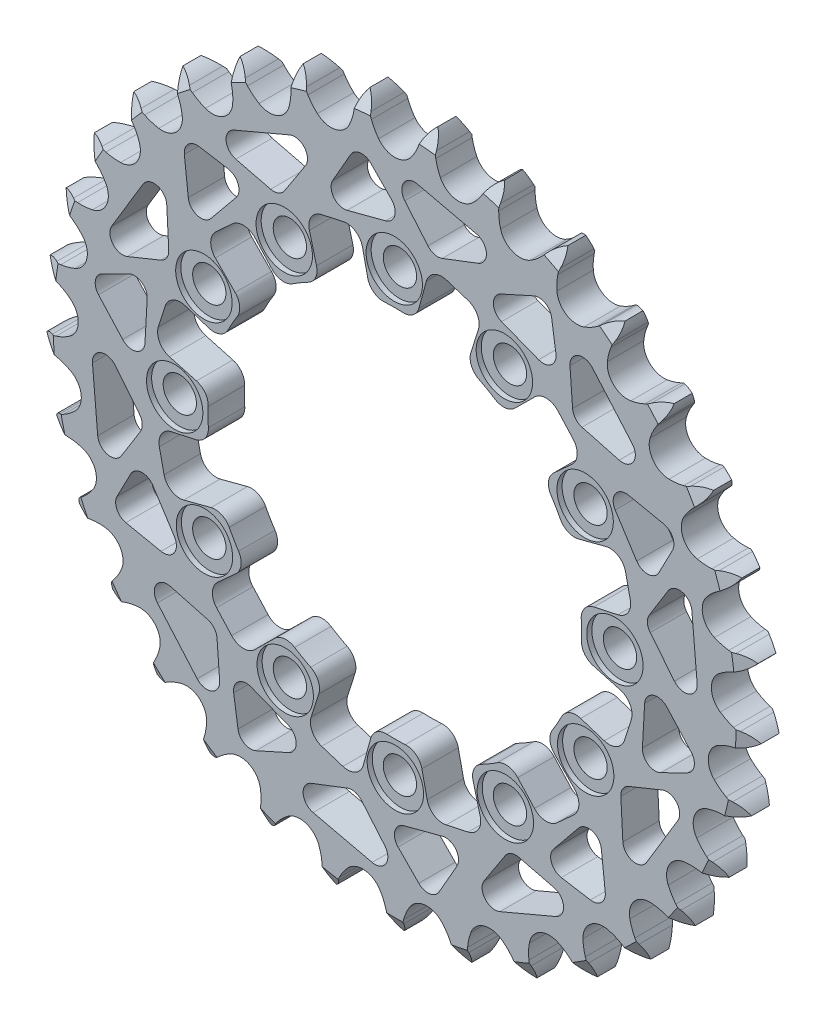
from build123d import *

# Parameters (mm, degrees)
EXTRUSION_DEPTH         = 7.2136
CIRPATTERN1_COUNT       = 12
CUT_EXTRUDE1_DEPTH      = 101.397293257
CUT_EXTRUDE1_DEPTH_BACK = 101.397293257
SKETCH8_R               = 37
CUT_EXTRUDE2_START      = 7.2136
SKETCH10_R              = 5.588
CUT_EXTRUDE2_DEPTH      = 1.016
CIRPATTERN2_COUNT       = 12
CUT_EXTRUDE5_REACH      = 102.397
CIRPATTERN3_COUNT       = 12
CUT_EXTRUDE7_REACH      = 102.397
CIRPATTERN4_COUNT       = 10
FILLET1_R               = 3.175


with BuildPart() as part:
    # Teeth Sketch → Extrusion (new body)
    with BuildSketch(Plane.XY):
        with BuildLine():
            ThreePointArc((6.734552875, 70.527428506), (5.727412099, 69.369502295), (5.022388138, 68.006393031))
            Line((5.022388138, 68.006393031), (4.635162245, 66.971544668))
            ThreePointArc((4.635162245, 66.971544668), (4.0137299, 65.635158722), (3.209237245, 64.400291471))
            ThreePointArc((3.209237245, 64.400291471), (0, 62.793862006), (-3.209237245, 64.400291471))
            ThreePointArc((-3.209237245, 64.400291471), (-4.0137299, 65.635158722), (-4.635162245, 66.971544668))
            Line((-4.635162245, 66.971544668), (-5.022388138, 68.006393031))
            ThreePointArc((-5.022388138, 68.006393031), (-5.727412099, 69.369502295), (-6.734552875, 70.527428506))
            ThreePointArc((-6.734552875, 70.527428506), (-7.504354329, 69.199824885), (-7.938667464, 67.727922119))
            Line((-7.938667464, 67.727922119), (-8.123049341, 66.638491832))
            ThreePointArc((-8.123049341, 66.638491832), (-8.48033889, 65.208649276), (-9.036593151, 63.84384645))
            ThreePointArc((-9.036593151, 63.84384645), (-11.883816523, 61.659095115), (-15.339077445, 62.629142165))
            ThreePointArc((-15.339077445, 62.629142165), (-16.362732034, 63.68944252), (-17.22584699, 64.884071387))
            Line((-17.22584699, 64.884071387), (-17.801921547, 65.826935709))
            ThreePointArc((-17.801921547, 65.826935709), (-18.752174931, 67.031985151), (-19.960254337, 67.978383482))
            ThreePointArc((-19.960254337, 67.978383482), (-20.464893839, 66.529085505), (-20.61279894, 65.001587639))
            Line((-20.61279894, 65.001587639), (-20.587672758, 63.896950277))
            ThreePointArc((-20.587672758, 63.896950277), (-20.667906137, 62.425329346), (-20.955817525, 60.979918474))
            ThreePointArc((-20.955817525, 60.979918474), (-23.338120953, 58.295807876), (-26.914523421, 58.594412483))
            ThreePointArc((-26.914523421, 58.594412483), (-28.120342399, 59.441823925), (-29.193944743, 60.451518712))
            Line((-29.193944743, 60.451518712), (-29.938047129, 61.268321421))
            ThreePointArc((-29.938047129, 61.268321421), (-31.099185303, 62.271757414), (-32.464540202, 62.972422563))
            ThreePointArc((-32.464540202, 62.972422563), (-32.685778765, 61.453811636), (-32.541930156, 59.925926421))
            Line((-32.541930156, 59.925926421), (-32.308204042, 58.846006456))
            ThreePointArc((-32.308204042, 58.846006456), (-32.108481407, 57.385795366), (-32.117644055, 55.912017363))
            ThreePointArc((-32.117644055, 55.912017363), (-33.948924886, 52.825558252), (-37.517208396, 52.441928068))
            ThreePointArc((-37.517208396, 52.441928068), (-38.861610323, 53.045822938), (-40.106897269, 53.834090646))
            Line((-40.106897269, 53.834090646), (-40.992133685, 54.495310364))
            ThreePointArc((-40.992133685, 54.495310364), (-42.32219009, 55.260866117), (-43.795472998, 55.69047422))
            ThreePointArc((-43.795472998, 55.69047422), (-43.725314484, 54.157436897), (-43.294911229, 52.684386087))
            Line((-43.294911229, 52.684386087), (-42.861032653, 51.668214641))
            ThreePointArc((-42.861032653, 51.668214641), (-42.388572501, 50.272189225), (-42.118655247, 48.823310267))
            ThreePointArc((-42.118655247, 48.823310267), (-43.33272622, 45.446055318), (-46.763923708, 44.394055736))
            ThreePointArc((-46.763923708, 44.394055736), (-48.198318397, 44.732607702), (-49.570282031, 45.270958281))
            Line((-49.570282031, 45.270958281), (-50.564657725, 45.752696804))
            ThreePointArc((-50.564657725, 45.752696804), (-52.015560657, 46.252703137), (-53.543523293, 46.395727039))
            ThreePointArc((-53.543523293, 46.395727039), (-53.184503413, 44.903671283), (-52.483101407, 43.538694772))
            Line((-52.483101407, 43.538694772), (-51.864751871, 42.622998928))
            ThreePointArc((-51.864751871, 42.622998928), (-51.136630142, 41.341615182), (-50.597388499, 39.970001531))
            ThreePointArc((-50.597388499, 39.970001531), (-51.150369926, 36.424013535), (-54.320468976, 34.741666562))
            ThreePointArc((-54.320468976, 34.741666562), (-55.793013665, 34.802639473), (-57.242067645, 35.071615531))
            Line((-57.242067645, 35.071615531), (-58.309643291, 35.356461573))
            ThreePointArc((-58.309643291, 35.356461573), (-59.828953337, 35.572846956), (-61.356371149, 35.424117399))
            ThreePointArc((-61.356371149, 35.424117399), (-60.721465817, 34.026969994), (-59.774415556, 32.819401589))
            Line((-59.774415556, 32.819401589), (-58.993943824, 32.037276981))
            ThreePointArc((-58.993943824, 32.037276981), (-58.036476735, 30.916847451), (-57.2474003, 29.672072798))
            ThreePointArc((-57.2474003, 29.672072798), (-57.119305992, 26.085513002), (-59.913730964, 23.83362304))
            ThreePointArc((-59.913730964, 23.83362304), (-61.371204052, 23.614813176), (-62.844975793, 23.604693218))
            Line((-62.844975793, 23.604693218), (-63.947166423, 23.682351702))
            ThreePointArc((-63.947166423, 23.682351702), (-65.479971761, 23.607295402), (-66.951639889, 23.17218786))
            ThreePointArc((-66.951639889, 23.17218786), (-66.063796239, 21.920445353), (-64.905326586, 20.913929722))
            Line((-64.905326586, 20.913929722), (-63.99094094, 20.293644371))
            ThreePointArc((-63.99094094, 20.293644371), (-62.838733846, 19.374664301), (-61.828341898, 18.301718044))
            ThreePointArc((-61.828341898, 18.301718044), (-61.023801517, 14.804214063), (-63.341554612, 12.064170283))
            ThreePointArc((-63.341554612, 12.064170283), (-64.731279223, 11.573486003), (-66.176502774, 11.28463579))
            Line((-66.176502774, 11.28463579), (-67.273472348, 11.152299936))
            ThreePointArc((-67.273472348, 11.152299936), (-68.764373399, 10.788514683), (-70.127101923, 10.082755077))
            ThreePointArc((-70.127101923, 10.082755077), (-69.018408937, 9.021658703), (-67.690390004, 8.252573944))
            Line((-67.690390004, 8.252573944), (-66.675138724, 7.816546579))
            ThreePointArc((-66.675138724, 7.816546579), (-65.369835391, 7.132230303), (-64.174646128, 6.269891516))
            ThreePointArc((-64.174646128, 6.269891516), (-62.722737859, 2.987852256), (-64.480049441, -0.14131302))
            ThreePointArc((-64.480049441, -0.14131302), (-65.751797307, -0.886137108), (-67.116238523, -1.443277777))
            Line((-67.116238523, -1.443277777), (-68.168339704, -1.780825007))
            ThreePointArc((-68.168339704, -1.780825007), (-69.563451418, -2.420191065), (-70.767987779, -3.371094744))
            ThreePointArc((-70.767987779, -3.371094744), (-69.478516511, -4.203194198), (-68.028946362, -4.707051357))
            Line((-68.028946362, -4.707051357), (-66.949523274, -4.943061572))
            ThreePointArc((-66.949523274, -4.943061572), (-65.538300765, -5.367981082), (-64.201511441, -5.988545228))
            ThreePointArc((-64.201511441, -5.988545228), (-62.154711032, -8.936498316), (-63.288067282, -12.341688903))
            ThreePointArc((-63.288067282, -12.341688903), (-64.395874122, -13.313732915), (-65.630218543, -14.119027525))
            Line((-65.630218543, -14.119027525), (-66.599425651, -14.649586294))
            ThreePointArc((-66.599425651, -14.649586294), (-67.848325057, -15.541424803), (-68.851134172, -16.703104419))
            ThreePointArc((-68.851134172, -16.703104419), (-67.427489473, -17.276132709), (-65.908759351, -17.496551559))
            Line((-65.908759351, -17.496551559), (-64.804177617, -17.524014599))
            ThreePointArc((-64.804177617, -17.524014599), (-63.338041192, -17.674179644), (-61.907966855, -18.030540344))
            ThreePointArc((-61.907966855, -18.030540344), (-59.340251006, -20.537860555), (-59.808689476, -24.096003993))
            ThreePointArc((-59.808689476, -24.096003993), (-60.712516265, -25.260135726), (-61.772151467, -26.284478831))
            Line((-61.772151467, -26.284478831), (-62.623434833, -26.988873364))
            ThreePointArc((-62.623434833, -26.988873364), (-63.680983452, -28.100950955), (-64.445821187, -29.43142038))
            ThreePointArc((-64.445821187, -29.43142038), (-62.939457285, -29.724666771), (-61.406458053, -29.6536808))
            Line((-61.406458053, -29.6536808), (-60.316640136, -29.471604079))
            ThreePointArc((-60.316640136, -29.471604079), (-58.848579784, -29.341587304), (-57.376907048, -29.420864754))
            ThreePointArc((-57.376907048, -29.420864754), (-54.381079699, -31.396931003), (-54.167669802, -34.979426717))
            ThreePointArc((-54.167669802, -34.979426717), (-54.834849884, -36.293571418), (-55.681477891, -37.499940589))
            Line((-55.681477891, -37.499940589), (-56.384069915, -38.352712231))
            ThreePointArc((-56.384069915, -38.352712231), (-57.212045185, -39.644835523), (-57.711268312, -41.096008126))
            ThreePointArc((-57.711268312, -41.096008126), (-56.176629123, -41.09887393), (-54.684767369, -40.739048756))
            Line((-54.684767369, -40.739048756), (-53.649102126, -40.354013001))
            ThreePointArc((-53.649102126, -40.354013001), (-52.232177374, -39.94851355), (-50.772096325, -39.747842457))
            ThreePointArc((-50.772096325, -39.747842457), (-47.456434483, -41.12123456), (-46.56888941, -44.598601821))
            ThreePointArc((-46.56888941, -44.598601821), (-46.975309158, -46.015262876), (-47.578330627, -47.360056788))
            Line((-47.578330627, -47.360056788), (-48.106837804, -48.330384151))
            ThreePointArc((-48.106837804, -48.330384151), (-48.675314541, -49.755852442), (-48.890879835, -51.275279063))
            ThreePointArc((-48.890879835, -51.275279063), (-47.383431219, -50.987660703), (-45.986626711, -50.352001344))
            Line((-45.986626711, -50.352001344), (-45.042545785, -49.777922752))
            ThreePointArc((-45.042545785, -49.777922752), (-43.727967985, -49.111596431), (-42.332249756, -48.638229571))
            ThreePointArc((-42.332249756, -48.638229571), (-38.816590078, -49.35930956), (-37.28698802, -52.605867255))
            ThreePointArc((-37.28698802, -52.605867255), (-37.417958367, -54.073842843), (-37.75557853, -55.50845714))
            Line((-37.75557853, -55.50845714), (-38.090899233, -56.561270064))
            ThreePointArc((-38.090899233, -56.561270064), (-38.379331208, -58.068563217), (-38.303447577, -59.601327819))
            ThreePointArc((-38.303447577, -59.601327819), (-36.877672653, -59.03362057), (-35.626409548, -58.145101414))
            Line((-35.626409548, -58.145101414), (-34.808034481, -57.402728679))
            ThreePointArc((-34.808034481, -57.402728679), (-33.6433159, -56.499658259), (-32.362405386, -55.770704343))
            ThreePointArc((-32.362405386, -55.770704343), (-28.773812973, -55.813410509), (-26.657437732, -58.711819583))
            ThreePointArc((-26.657437732, -58.711819583), (-26.508225068, -60.178053241), (-26.568241455, -61.650637225))
            Line((-26.568241455, -61.650637225), (-26.69825632, -62.747884308))
            ThreePointArc((-26.69825632, -62.747884308), (-26.696218847, -64.28252482), (-26.331628924, -65.773229298))
            ThreePointArc((-26.331628924, -65.773229298), (-25.039058915, -64.94595158), (-23.978561119, -63.836686022))
            Line((-23.978561119, -63.836686022), (-23.31547012, -62.952850431))
            ThreePointArc((-23.31547012, -62.952850431), (-22.342706722, -61.845675228), (-21.222899365, -60.887480551))
            ThreePointArc((-21.222899365, -60.887480551), (-17.691075297, -60.250269381), (-15.06441819, -62.69577378))
            ThreePointArc((-15.06441819, -62.69577378), (-14.640415448, -64.107272002), (-14.42065891, -65.564602652))
            Line((-14.42065891, -65.564602652), (-14.340668861, -66.666626525))
            ThreePointArc((-14.340668861, -66.666626525), (-14.048235582, -68.17314849), (-13.408116596, -69.567914899))
            ThreePointArc((-13.408116596, -69.567914899), (-12.295468348, -68.510966685), (-11.464065017, -67.221046473))
            Line((-11.464065017, -67.221046473), (-10.980223921, -66.227692145))
            ThreePointArc((-10.980223921, -66.227692145), (-10.23457391, -64.956428358), (-9.316342465, -63.80362457))
            ThreePointArc((-9.316342465, -63.80362457), (-5.968936066, -62.509526537), (-2.926931324, -64.413739359))
            ThreePointArc((-2.926931324, -64.413739359), (-2.24346307, -65.719486924), (-1.751876179, -67.108892511))
            Line((-1.751876179, -67.108892511), (-1.464772265, -68.175863162))
            ThreePointArc((-1.464772265, -68.175863162), (-0.89251248, -69.59981695), (0, -70.848234798))
            ThreePointArc((0, -70.848234798), (0.89251248, -69.59981695), (1.464772265, -68.175863162))
            Line((1.464772265, -68.175863162), (1.751876179, -67.108892511))
            ThreePointArc((1.751876179, -67.108892511), (2.24346307, -65.719486924), (2.926931324, -64.413739359))
            ThreePointArc((2.926931324, -64.413739359), (5.968936066, -62.509526537), (9.316342465, -63.80362457))
            ThreePointArc((9.316342465, -63.80362457), (10.23457391, -64.956428358), (10.980223921, -66.227692145))
            Line((10.980223921, -66.227692145), (11.464065017, -67.221046473))
            ThreePointArc((11.464065017, -67.221046473), (12.295468348, -68.510966685), (13.408116596, -69.567914899))
            ThreePointArc((13.408116596, -69.567914899), (14.048235582, -68.17314849), (14.340668861, -66.666626525))
            Line((14.340668861, -66.666626525), (14.42065891, -65.564602652))
            ThreePointArc((14.42065891, -65.564602652), (14.640415448, -64.107272002), (15.06441819, -62.69577378))
            ThreePointArc((15.06441819, -62.69577378), (17.691075297, -60.250269381), (21.222899365, -60.887480551))
            ThreePointArc((21.222899365, -60.887480551), (22.342706722, -61.845675228), (23.31547012, -62.952850431))
            Line((23.31547012, -62.952850431), (23.978561119, -63.836686022))
            ThreePointArc((23.978561119, -63.836686022), (25.039058915, -64.94595158), (26.331628924, -65.773229298))
            ThreePointArc((26.331628924, -65.773229298), (26.696218847, -64.28252482), (26.69825632, -62.747884308))
            Line((26.69825632, -62.747884308), (26.568241455, -61.650637225))
            ThreePointArc((26.568241455, -61.650637225), (26.508225068, -60.178053241), (26.657437732, -58.711819583))
            ThreePointArc((26.657437732, -58.711819583), (28.773812973, -55.813410509), (32.362405386, -55.770704343))
            ThreePointArc((32.362405386, -55.770704343), (33.6433159, -56.499658259), (34.808034481, -57.402728679))
            Line((34.808034481, -57.402728679), (35.626409548, -58.145101414))
            ThreePointArc((35.626409548, -58.145101414), (36.877672653, -59.03362057), (38.303447577, -59.601327819))
            ThreePointArc((38.303447577, -59.601327819), (38.379331208, -58.068563217), (38.090899233, -56.561270064))
            Line((38.090899233, -56.561270064), (37.75557853, -55.50845714))
            ThreePointArc((37.75557853, -55.50845714), (37.417958367, -54.073842843), (37.28698802, -52.605867255))
            ThreePointArc((37.28698802, -52.605867255), (38.816590078, -49.35930956), (42.332249756, -48.638229571))
            ThreePointArc((42.332249756, -48.638229571), (43.727967985, -49.111596431), (45.042545785, -49.777922752))
            Line((45.042545785, -49.777922752), (45.986626711, -50.352001344))
            ThreePointArc((45.986626711, -50.352001344), (47.383431219, -50.987660703), (48.890879835, -51.275279063))
            ThreePointArc((48.890879835, -51.275279063), (48.675314541, -49.755852442), (48.106837804, -48.330384151))
            Line((48.106837804, -48.330384151), (47.578330627, -47.360056788))
            ThreePointArc((47.578330627, -47.360056788), (46.975309158, -46.015262876), (46.56888941, -44.598601821))
            ThreePointArc((46.56888941, -44.598601821), (47.456434483, -41.12123456), (50.772096325, -39.747842457))
            ThreePointArc((50.772096325, -39.747842457), (52.232177374, -39.94851355), (53.649102126, -40.354013001))
            Line((53.649102126, -40.354013001), (54.684767369, -40.739048756))
            ThreePointArc((54.684767369, -40.739048756), (56.176629123, -41.09887393), (57.711268312, -41.096008126))
            ThreePointArc((57.711268312, -41.096008126), (57.212045185, -39.644835523), (56.384069915, -38.352712231))
            Line((56.384069915, -38.352712231), (55.681477891, -37.499940589))
            ThreePointArc((55.681477891, -37.499940589), (54.834849884, -36.293571418), (54.167669802, -34.979426717))
            ThreePointArc((54.167669802, -34.979426717), (54.381079699, -31.396931003), (57.376907048, -29.420864754))
            ThreePointArc((57.376907048, -29.420864754), (58.848579784, -29.341587304), (60.316640136, -29.471604079))
            Line((60.316640136, -29.471604079), (61.406458053, -29.6536808))
            ThreePointArc((61.406458053, -29.6536808), (62.939457285, -29.724666771), (64.445821187, -29.43142038))
            ThreePointArc((64.445821187, -29.43142038), (63.680983452, -28.100950955), (62.623434833, -26.988873364))
            Line((62.623434833, -26.988873364), (61.772151467, -26.284478831))
            ThreePointArc((61.772151467, -26.284478831), (60.712516265, -25.260135726), (59.808689476, -24.096003993))
            ThreePointArc((59.808689476, -24.096003993), (59.340251006, -20.537860555), (61.907966855, -18.030540344))
            ThreePointArc((61.907966855, -18.030540344), (63.338041192, -17.674179644), (64.804177617, -17.524014599))
            Line((64.804177617, -17.524014599), (65.908759351, -17.496551559))
            ThreePointArc((65.908759351, -17.496551559), (67.427489473, -17.276132709), (68.851134172, -16.703104419))
            ThreePointArc((68.851134172, -16.703104419), (67.848325057, -15.541424803), (66.599425651, -14.649586294))
            Line((66.599425651, -14.649586294), (65.630218543, -14.119027525))
            ThreePointArc((65.630218543, -14.119027525), (64.395874122, -13.313732915), (63.288067282, -12.341688903))
            ThreePointArc((63.288067282, -12.341688903), (62.154711032, -8.936498316), (64.201511441, -5.988545228))
            ThreePointArc((64.201511441, -5.988545228), (65.538300765, -5.367981082), (66.949523274, -4.943061572))
            Line((66.949523274, -4.943061572), (68.028946362, -4.707051357))
            ThreePointArc((68.028946362, -4.707051357), (69.478516511, -4.203194198), (70.767987779, -3.371094744))
            ThreePointArc((70.767987779, -3.371094744), (69.563451418, -2.420191065), (68.168339704, -1.780825007))
            Line((68.168339704, -1.780825007), (67.116238523, -1.443277777))
            ThreePointArc((67.116238523, -1.443277777), (65.751797307, -0.886137108), (64.480049441, -0.14131302))
            ThreePointArc((64.480049441, -0.14131302), (62.722737859, 2.987852256), (64.174646128, 6.269891516))
            ThreePointArc((64.174646128, 6.269891516), (65.369835391, 7.132230303), (66.675138724, 7.816546579))
            Line((66.675138724, 7.816546579), (67.690390004, 8.252573944))
            ThreePointArc((67.690390004, 8.252573944), (69.018408937, 9.021658703), (70.127101923, 10.082755077))
            ThreePointArc((70.127101923, 10.082755077), (68.764373399, 10.788514683), (67.273472348, 11.152299936))
            Line((67.273472348, 11.152299936), (66.176502774, 11.28463579))
            ThreePointArc((66.176502774, 11.28463579), (64.731279223, 11.573486003), (63.341554612, 12.064170283))
            ThreePointArc((63.341554612, 12.064170283), (61.023801517, 14.804214063), (61.828341898, 18.301718044))
            ThreePointArc((61.828341898, 18.301718044), (62.838733846, 19.374664301), (63.99094094, 20.293644371))
            Line((63.99094094, 20.293644371), (64.905326586, 20.913929722))
            ThreePointArc((64.905326586, 20.913929722), (66.063796239, 21.920445353), (66.951639889, 23.17218786))
            ThreePointArc((66.951639889, 23.17218786), (65.479971761, 23.607295402), (63.947166423, 23.682351702))
            Line((63.947166423, 23.682351702), (62.844975793, 23.604693218))
            ThreePointArc((62.844975793, 23.604693218), (61.371204052, 23.614813176), (59.913730964, 23.83362304))
            ThreePointArc((59.913730964, 23.83362304), (57.119305992, 26.085513002), (57.2474003, 29.672072798))
            ThreePointArc((57.2474003, 29.672072798), (58.036476735, 30.916847451), (58.993943824, 32.037276981))
            Line((58.993943824, 32.037276981), (59.774415556, 32.819401589))
            ThreePointArc((59.774415556, 32.819401589), (60.721465817, 34.026969994), (61.356371149, 35.424117399))
            ThreePointArc((61.356371149, 35.424117399), (59.828953337, 35.572846956), (58.309643291, 35.356461573))
            Line((58.309643291, 35.356461573), (57.242067645, 35.071615531))
            ThreePointArc((57.242067645, 35.071615531), (55.793013665, 34.802639473), (54.320468976, 34.741666562))
            ThreePointArc((54.320468976, 34.741666562), (51.150369926, 36.424013535), (50.597388499, 39.970001531))
            ThreePointArc((50.597388499, 39.970001531), (51.136630142, 41.341615182), (51.864751871, 42.622998928))
            Line((51.864751871, 42.622998928), (52.483101407, 43.538694772))
            ThreePointArc((52.483101407, 43.538694772), (53.184503413, 44.903671283), (53.543523293, 46.395727039))
            ThreePointArc((53.543523293, 46.395727039), (52.015560657, 46.252703137), (50.564657725, 45.752696804))
            Line((50.564657725, 45.752696804), (49.570282031, 45.270958281))
            ThreePointArc((49.570282031, 45.270958281), (48.198318397, 44.732607702), (46.763923708, 44.394055736))
            ThreePointArc((46.763923708, 44.394055736), (43.33272622, 45.446055318), (42.118655247, 48.823310267))
            ThreePointArc((42.118655247, 48.823310267), (42.388572501, 50.272189225), (42.861032653, 51.668214641))
            Line((42.861032653, 51.668214641), (43.294911229, 52.684386087))
            ThreePointArc((43.294911229, 52.684386087), (43.725314484, 54.157436897), (43.795472998, 55.69047422))
            ThreePointArc((43.795472998, 55.69047422), (42.32219009, 55.260866117), (40.992133685, 54.495310364))
            Line((40.992133685, 54.495310364), (40.106897269, 53.834090646))
            ThreePointArc((40.106897269, 53.834090646), (38.861610323, 53.045822938), (37.517208396, 52.441928068))
            ThreePointArc((37.517208396, 52.441928068), (33.948924886, 52.825558252), (32.117644055, 55.912017363))
            ThreePointArc((32.117644055, 55.912017363), (32.108481407, 57.385795366), (32.308204042, 58.846006456))
            Line((32.308204042, 58.846006456), (32.541930156, 59.925926421))
            ThreePointArc((32.541930156, 59.925926421), (32.685778765, 61.453811636), (32.464540202, 62.972422563))
            ThreePointArc((32.464540202, 62.972422563), (31.099185303, 62.271757414), (29.938047129, 61.268321421))
            Line((29.938047129, 61.268321421), (29.193944743, 60.451518712))
            ThreePointArc((29.193944743, 60.451518712), (28.120342399, 59.441823925), (26.914523421, 58.594412483))
            ThreePointArc((26.914523421, 58.594412483), (23.338120953, 58.295807876), (20.955817525, 60.979918474))
            ThreePointArc((20.955817525, 60.979918474), (20.667906137, 62.425329346), (20.587672758, 63.896950277))
            Line((20.587672758, 63.896950277), (20.61279894, 65.001587639))
            ThreePointArc((20.61279894, 65.001587639), (20.464893839, 66.529085505), (19.960254337, 67.978383482))
            ThreePointArc((19.960254337, 67.978383482), (18.752174931, 67.031985151), (17.801921547, 65.826935709))
            Line((17.801921547, 65.826935709), (17.22584699, 64.884071387))
            ThreePointArc((17.22584699, 64.884071387), (16.362732034, 63.68944252), (15.339077445, 62.629142165))
            ThreePointArc((15.339077445, 62.629142165), (11.883816523, 61.659095115), (9.036593151, 63.84384645))
            ThreePointArc((9.036593151, 63.84384645), (8.48033889, 65.208649276), (8.123049341, 66.638491832))
            Line((8.123049341, 66.638491832), (7.938667464, 67.727922119))
            ThreePointArc((7.938667464, 67.727922119), (7.504354329, 69.199824885), (6.734552875, 70.527428506))
        make_face()
    extrude(amount=EXTRUSION_DEPTH)

    # Sketch7 → M6 Clearance Hole1 (revolve, cut)
    with BuildSketch(Plane(origin=(0, 43.500000122, 0), x_dir=(0, 1, 0), z_dir=(1, 0, 0))):
        Polygon((0, 0), (0, 19.254840043), (3.3, 17.272), (3.3, 0), align=None)
    m6_clearance_hole1 = revolve(axis=Axis((0, 43.500000122, -6.35), (0, 0, 1)), mode=Mode.SUBTRACT)

    # CirPattern1: M6 Clearance Hole1 ×12 about axis
    cirpattern1_axis = Axis((0, -0.110734981, 0), (0, 0, 1))
    for i in range(1, CIRPATTERN1_COUNT):
        add(m6_clearance_hole1.rotate(cirpattern1_axis, i * 360 / CIRPATTERN1_COUNT), mode=Mode.SUBTRACT)

    # Sketch8 → Cut-Extrude1 (cut, two sides: drawn at the far end of the back side and taken through both)
    with BuildSketch(Plane(origin=(0, 0, 0), x_dir=(-1, 0, 0), z_dir=(0, 0, -1)).offset(-CUT_EXTRUDE1_DEPTH_BACK)):
        Circle(SKETCH8_R)
    extrude(amount=CUT_EXTRUDE1_DEPTH + CUT_EXTRUDE1_DEPTH_BACK, mode=Mode.SUBTRACT)

    # Sketch5 → Cut-Revolve1 (revolve, cut)
    with BuildSketch(Plane(origin=(0, 0, 0), x_dir=(0, 0, -1), z_dir=(1, 0, 0))):
        Polygon((-7.2136, -67.654652666), (-7.2136, -70.848234798), (-5.3848, -70.848234798), align=None)
    cut_revolve1 = revolve(axis=Axis((0, 0, 7.2136), (0, 0, -1)), mode=Mode.SUBTRACT)

    # Mirror1: Cut-Revolve1 across plane
    add(cut_revolve1.mirror(Plane.XY.offset(3.6068)), mode=Mode.SUBTRACT)

    # Sketch10 → Cut-Extrude2 (cut)
    with BuildSketch(Plane.XY.offset(CUT_EXTRUDE2_START)):
        with Locations((-43.610735103, -0.110734981)):
            Circle(SKETCH10_R)
    cut_extrude2 = extrude(amount=-CUT_EXTRUDE2_DEPTH, mode=Mode.SUBTRACT)

    # CirPattern2: Cut-Extrude2 ×12 about axis
    cirpattern2_axis = Axis((0, 0, 0), (0, 0, 1))
    for i in range(1, CIRPATTERN2_COUNT):
        add(cut_extrude2.rotate(cirpattern2_axis, i * 360 / CIRPATTERN2_COUNT), mode=Mode.SUBTRACT)

    # Sketch12 → Cut-Extrude5 (cut, up to next)
    with BuildSketch(Plane.XY.offset(7.2136), mode=Mode.PRIVATE) as cut_extrude5_sk1:
        with BuildLine():
            Line((6.250553131, 44.666758148), (4.490126769, 38.246443199))
            ThreePointArc((4.490126769, 38.246443199), (4.793284827, 35.835387705), (6.712523637, 34.344879133))
            Line((6.712523637, 34.344879133), (10.729526032, 33.243432091))
            ThreePointArc((10.729526032, 33.243432091), (13.083067136, 33.514613806), (14.593666251, 35.339657796))
            Line((14.593666251, 35.339657796), (16.564401951, 41.511619817))
            ThreePointArc((16.564401951, 41.511619817), (16.361421568, 43.933167333), (14.505600093, 45.501931197))
            Line((14.505600093, 45.501931197), (10.278288359, 46.851731167))
            ThreePointArc((10.278288359, 46.851731167), (7.798576093, 46.6179733), (6.250553131, 44.666758148))
        make_face()
    cut_extrude5_tool1 = extrude(cut_extrude5_sk1.sketch, amount=-CUT_EXTRUDE5_REACH, mode=Mode.PRIVATE) & part.part
    cut_extrude5 = cut_extrude5_tool1.solids().sort_by_distance((10.48706, 40.048077, 7.2136))[0]
    add(cut_extrude5, mode=Mode.SUBTRACT)

    # CirPattern3: Cut-Extrude5 ×12 about axis
    cirpattern3_axis = Axis((0, 0, 0), (0, 0, 1))
    for i in range(1, CIRPATTERN3_COUNT):
        add(cut_extrude5.rotate(cirpattern3_axis, i * 360 / CIRPATTERN3_COUNT), mode=Mode.SUBTRACT)

    # Sketch13 → Cut-Extrude7 (cut, up to next)
    with BuildSketch(Plane.XY.offset(7.2136), mode=Mode.PRIVATE) as cut_extrude7_sk1:
        with BuildLine():
            Line((-12.29503781, 52.699348233), (-8.766956721, 58.874555746))
            ThreePointArc((-8.766956721, 58.874555746), (-6.886929375, 60.133596514), (-4.748676784, 59.393621964))
            Line((-4.748676784, 59.393621964), (-0.656757873, 55.224069994))
            ThreePointArc((-0.656757873, 55.224069994), (-0.020757561, 52.770631729), (-1.823075281, 50.988636624))
            Line((-1.823075281, 50.988636624), (-9.443075281, 48.982981081))
            ThreePointArc((-9.443075281, 48.982981081), (-12.104647123, 49.892965008), (-12.29503781, 52.699348233))
        make_face()
    cut_extrude7_tool1 = extrude(cut_extrude7_sk1.sketch, amount=-CUT_EXTRUDE7_REACH, mode=Mode.PRIVATE) & part.part
    # Sketch13 → Cut-Extrude7 (cut, up to next)
    with BuildSketch(Plane.XY.offset(7.2136), mode=Mode.PRIVATE) as cut_extrude7_sk2:
        with BuildLine():
            Line((1.979717897, 56.320855635), (6.567308468, 50.886285113))
            ThreePointArc((6.567308468, 50.886285113), (7.875401815, 50.064805257), (9.417527045, 50.153050025))
            Line((9.417527045, 50.153050025), (16.53250792, 52.880951625))
            ThreePointArc((16.53250792, 52.880951625), (18.15709085, 55.428778294), (16.195570256, 57.727283763))
            Line((16.195570256, 57.727283763), (4.49299881, 60.433952684))
            ThreePointArc((4.49299881, 60.433952684), (1.753234812, 59.28365705), (1.979717897, 56.320855635))
        make_face()
    cut_extrude7_tool2 = extrude(cut_extrude7_sk2.sketch, amount=-CUT_EXTRUDE7_REACH, mode=Mode.PRIVATE) & part.part
    cut_extrude7_1 = cut_extrude7_tool1.solids().sort_by_distance((-6.467527, 54.029656, 7.2136))[0]
    add(cut_extrude7_1, mode=Mode.SUBTRACT)
    cut_extrude7_2 = cut_extrude7_tool2.solids().sort_by_distance((9.466435, 55.47639, 7.2136))[0]
    add(cut_extrude7_2, mode=Mode.SUBTRACT)
    cut_extrude7 = cut_extrude7_1 + cut_extrude7_2  # Cut-Extrude7 as one shape, for the pattern or mirror that repeats it

    # CirPattern4: Cut-Extrude7 ×10 about axis
    cirpattern4_axis = Axis((0, 0, 0), (0, 0, 1))
    for i in range(1, CIRPATTERN4_COUNT):
        add(cut_extrude7.rotate(cirpattern4_axis, i * 360 / CIRPATTERN4_COUNT), mode=Mode.SUBTRACT)

    # Fillet1
    fillet1_edges = [part.edges().sort_by_distance(p)[0] for p in [
        (5.00954039, -36.659303118, 3.6068),
        (-4.449777797, -36.731450796, 3.6068),
        (22.668040798, -29.24311759, 3.6068),
        (14.512104784, -34.035258405, 3.6068),
        (29.585480608, -22.219346011, 3.6068),
        (34.25265798, -13.99126232, 3.6068),
        (36.731450796, -4.449777797, 3.6068),
        (36.659303118, 5.00954039, 3.6068),
        (29.24311759, 22.668040798, 3.6068),
        (34.035258405, 14.512104784, 3.6068),
        (-13.99126232, -34.25265798, 3.6068),
        (-22.219346011, -29.585480608, 3.6068),
        (-29.24311759, -22.668040798, 3.6068),
        (-34.035258405, -14.512104784, 3.6068),
        (-36.659303118, -5.00954039, 3.6068),
        (-36.731450796, 4.449777797, 3.6068),
        (-34.25265798, 13.99126232, 3.6068),
        (-29.585480608, 22.219346011, 3.6068),
        (-22.668040798, 29.24311759, 3.6068),
        (-5.00954039, 36.659303118, 3.6068),
        (-14.512104784, 34.035258405, 3.6068),
        (4.449777797, 36.731450796, 3.6068),
        (13.99126232, 34.25265798, 3.6068),
        (22.219346011, 29.585480608, 3.6068),
    ]]
    fillet(fillet1_edges, radius=FILLET1_R)


solid = part.part
